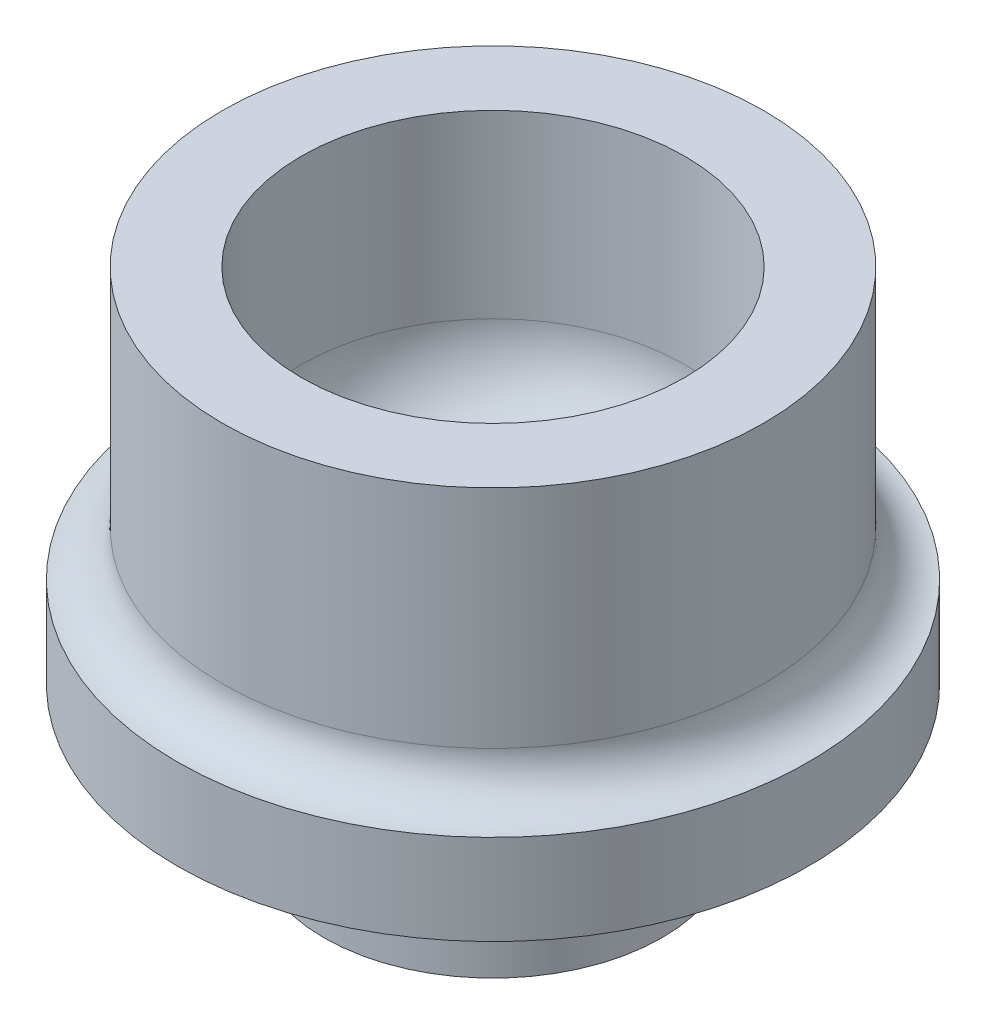
from build123d import *

# Parameters (mm, degrees)
CROQUIS1_R              = 7
SALIENTE_EXTRUIR1_DEPTH = 2
CROQUIS2_R              = 6
CROQUIS2_R_2            = 4.25
SALIENTE_EXTRUIR2_DEPTH = 6
REDONDEO3_R             = 2
REDONDEO4_R             = 1
CROQUIS3_R              = 3.75
CROQUIS3_R_2            = 3.25
SALIENTE_EXTRUIR3_DEPTH = 3


with BuildPart() as part:
    # Croquis1 → Saliente-Extruir1 (new body)
    with BuildSketch(Plane(origin=(0, 0, 0), x_dir=(1, 0, 0), z_dir=(0, 1, 0))):
        with Locations(Location((0, 0, 0), (0, 0, 270))):
            Circle(CROQUIS1_R)
    extrude(amount=SALIENTE_EXTRUIR1_DEPTH)

    # Croquis2 → Saliente-Extruir2 (add)
    with BuildSketch(Plane(origin=(0, 2, 0), x_dir=(1, 0, 0), z_dir=(0, 1, 0))):
        with Locations(Location((0, 0, 0), (0, 0, 270))):
            Circle(CROQUIS2_R)
        with Locations(Location((0, 0, 0), (0, 0, 270))):
            Circle(CROQUIS2_R_2, mode=Mode.SUBTRACT)
    extrude(amount=SALIENTE_EXTRUIR2_DEPTH)

    # Redondeo3
    redondeo3_edges = [part.edges().sort_by_distance(p)[0] for p in [
        (0, 2, -4.25),
    ]]
    fillet(redondeo3_edges, radius=REDONDEO3_R)

    # Redondeo4
    redondeo4_edges = [part.edges().sort_by_distance(p)[0] for p in [
        (0, 2, -6),
    ]]
    fillet(redondeo4_edges, radius=REDONDEO4_R - 0.0001)  # a hair under: the kernel refuses the full size

    # Croquis3 → Saliente-Extruir3 (add)
    with BuildSketch(Plane.XZ):
        with Locations(Location((0, 0, 0), (0, 0, 90))):
            Circle(CROQUIS3_R)
        with Locations(Location((0, 0, 0), (0, 0, 270))):
            Circle(CROQUIS3_R_2, mode=Mode.SUBTRACT)
    extrude(amount=SALIENTE_EXTRUIR3_DEPTH)


solid = part.part
